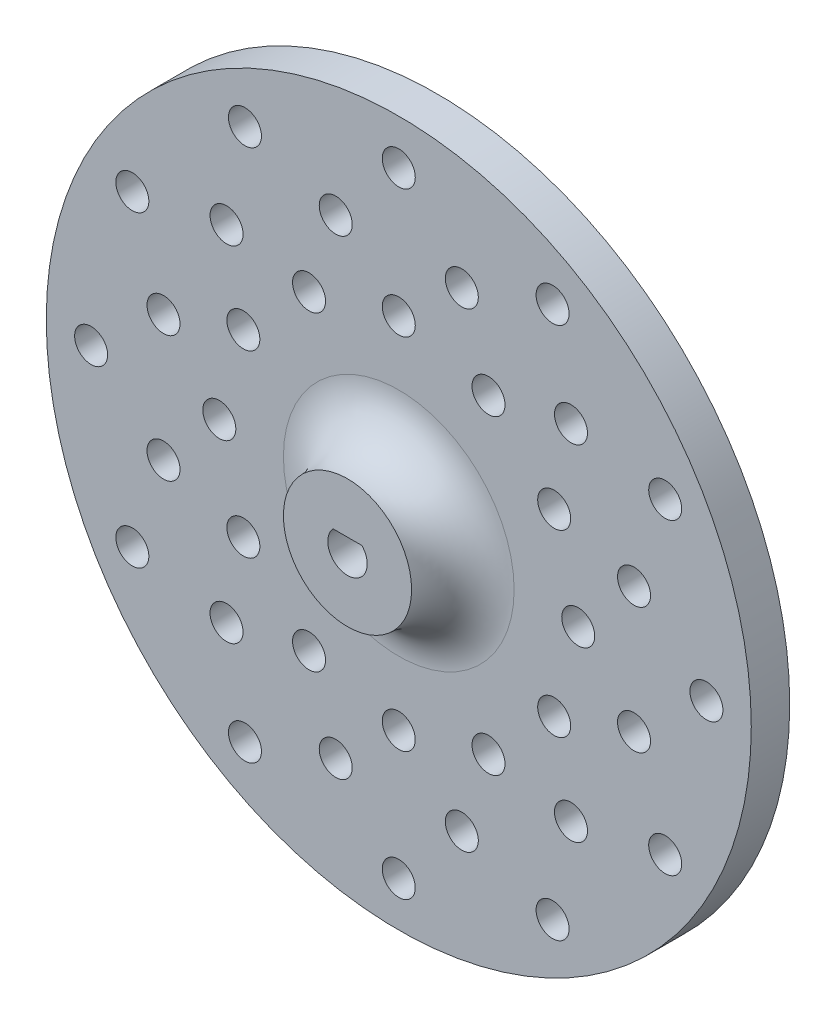
from build123d import *
from build123d.topology import SkipClean

# Parameters (mm, degrees)
ESBO_O1_R                = 55
RESSALTO_EXTRUS_O1_DEPTH = 6
ESBO_O2_R                = 10
RESSALTO_EXTRUS_O2_DEPTH = 8
FILETE3_R                = 8
ESBO_O3_R                = 2.575
CORTE_EXTRUS_O1_DEPTH    = 79.192071209
PADR_OCIRCULAR1_COUNT    = 12
CORTE_EXTRUS_O2_DEPTH    = 79.192071209
ESBO_O5_R                = 2.575
CORTE_EXTRUS_O3_DEPTH    = 79.192071209
PADR_OCIRCULAR2_COUNT    = 12
ESBO_O6_R                = 2.575
CORTE_EXTRUS_O4_DEPTH    = 79.192071209
PADR_OCIRCULAR3_COUNT    = 12


with BuildPart() as part:
    # Esboço1 → Ressalto-extrusão1 (new body)
    with BuildSketch(Plane.XY):
        Circle(ESBO_O1_R)
    extrude(amount=RESSALTO_EXTRUS_O1_DEPTH)

    # Esboço2 → Ressalto-extrusão2 (add)
    with BuildSketch(Plane.XY.offset(6)):
        Circle(ESBO_O2_R)
        with BuildLine():
            Line((-2.24624687, 2.1), (2.24624687, 2.1))
            ThreePointArc((2.24624687, 2.1), (0, -3.075), (-2.24624687, 2.1))
        make_face(mode=Mode.SUBTRACT)
    extrude(amount=RESSALTO_EXTRUS_O2_DEPTH)

    # Filete3
    filete3_edges = [part.edges().sort_by_distance(p)[0] for p in [
        (-10, 0, 6),
    ]]
    fillet(filete3_edges, radius=FILETE3_R - 0.0001)  # a hair under: the kernel refuses the full size

    # Esboço3 → Corte-extrusão1 (cut, through all)
    with BuildSketch(Plane.XY.offset(6)):
        with Locations((0, 48)):
            Circle(ESBO_O3_R)
    corte_extrus_o1 = extrude(amount=-CORTE_EXTRUS_O1_DEPTH, mode=Mode.SUBTRACT)

    # PadrãoCircular1: Corte-extrusão1 ×12 about axis
    padr_ocircular1_axis = Axis((0, 0, 0), (0, 0, 1))
    for i in range(1, PADR_OCIRCULAR1_COUNT):
        add(corte_extrus_o1.rotate(padr_ocircular1_axis, i * 360 / PADR_OCIRCULAR1_COUNT), mode=Mode.SUBTRACT)

    # Esboço4 → Corte-extrusão2 (cut, through all)
    with SkipClean():  # the faces are left unmerged after this step: merging them gives an invalid solid
        with BuildSketch(Plane.XY.offset(6)):
            with BuildLine():
                Line((2.24624687, 2.1), (-2.24624687, 2.1))
                ThreePointArc((-2.24624687, 2.1), (0, -3.075), (2.24624687, 2.1))
            make_face()
        extrude(amount=-CORTE_EXTRUS_O2_DEPTH, mode=Mode.SUBTRACT)

    # Esboço5 → Corte-extrusão3 (cut, through all)
    with SkipClean():  # the faces are left unmerged after this step: merging them gives an invalid solid
        with BuildSketch(Plane.XY.offset(6)):
            with Locations((9.835123714, 36.705181399)):
                Circle(ESBO_O5_R)
        corte_extrus_o3 = extrude(amount=-CORTE_EXTRUS_O3_DEPTH, mode=Mode.SUBTRACT)

    # PadrãoCircular2: Corte-extrusão3 ×12 about axis
    with SkipClean():  # the faces are left unmerged after this step: merging them gives an invalid solid
        padr_ocircular2_axis = Axis((0, 0, 0), (0, 0, 1))
        for i in range(1, PADR_OCIRCULAR2_COUNT):
            add(corte_extrus_o3.rotate(padr_ocircular2_axis, i * 360 / PADR_OCIRCULAR2_COUNT), mode=Mode.SUBTRACT)

    # Esboço6 → Corte-extrusão4 (cut, through all)
    with SkipClean():  # the faces are left unmerged after this step: merging them gives an invalid solid
        with BuildSketch(Plane.XY.offset(6)):
            with Locations((0, 28)):
                Circle(ESBO_O6_R)
        corte_extrus_o4 = extrude(amount=-CORTE_EXTRUS_O4_DEPTH, mode=Mode.SUBTRACT)

    # PadrãoCircular3: Corte-extrusão4 ×12 about axis
    with SkipClean():  # the faces are left unmerged after this step: merging them gives an invalid solid
        padr_ocircular3_axis = Axis((0, 0, 0), (0, 0, 1))
        for i in range(1, PADR_OCIRCULAR3_COUNT):
            add(corte_extrus_o4.rotate(padr_ocircular3_axis, i * 360 / PADR_OCIRCULAR3_COUNT), mode=Mode.SUBTRACT)


solid = part.part
